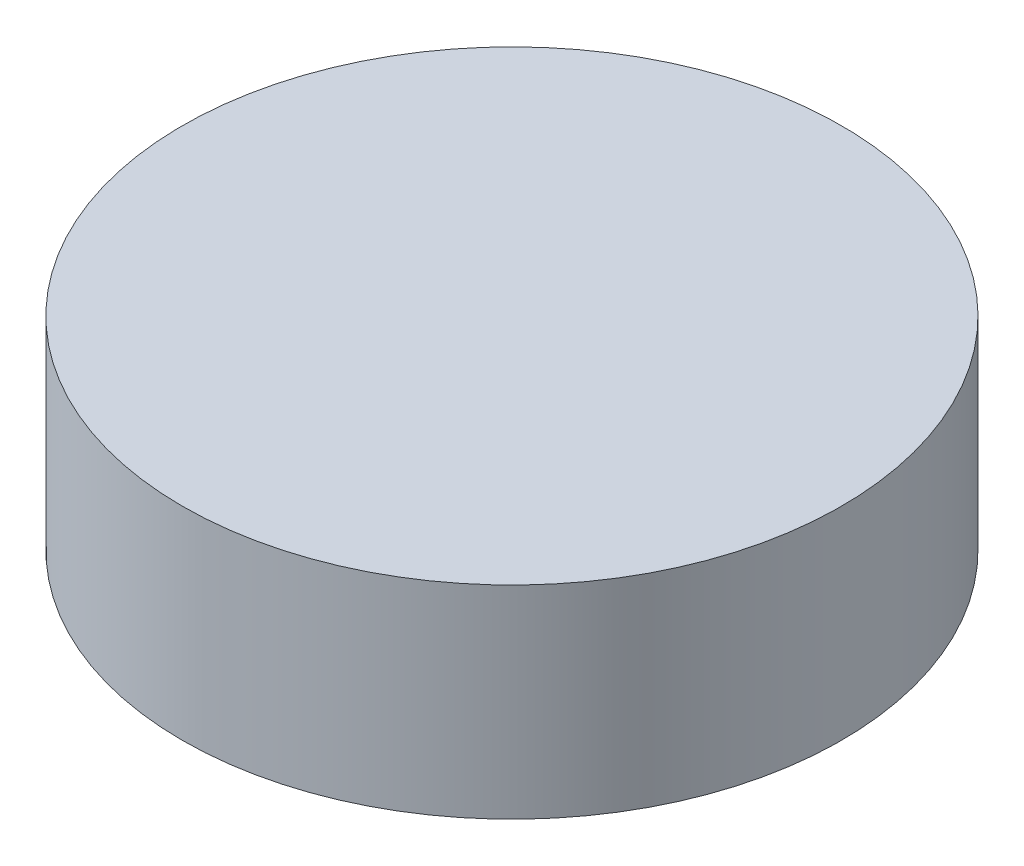
from build123d import *

# Parameters (mm, degrees)
SKETCH1_R           = 32.5
BOSS_EXTRUDE1_DEPTH = 10
SKETCH2_R           = 25.5
CUT_EXTRUDE1_DEPTH  = 15


with BuildPart() as part:
    # Sketch1 → Boss-Extrude1 (new, symmetric)
    with BuildSketch(Plane(origin=(0, 0, 0), x_dir=(1, 0, 0), z_dir=(0, 1, 0))):
        Circle(SKETCH1_R)
    extrude(amount=BOSS_EXTRUDE1_DEPTH, both=True)

    # Sketch2 → Cut-Extrude1 (cut)
    with BuildSketch(Plane.XZ.offset(10)):
        Circle(SKETCH2_R)
    extrude(amount=-CUT_EXTRUDE1_DEPTH, mode=Mode.SUBTRACT)


solid = part.part
